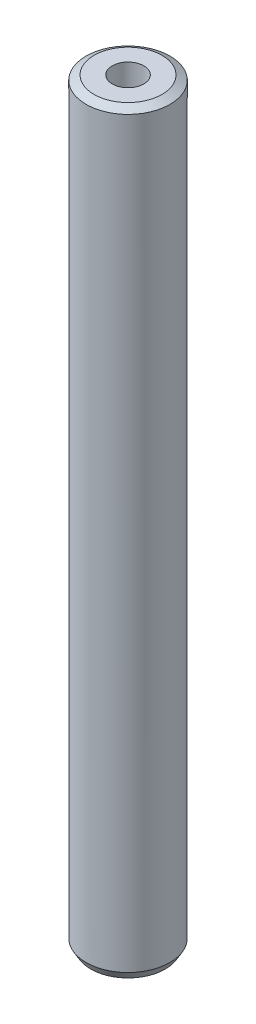
from build123d import *
from OCP.BRepFilletAPI import BRepFilletAPI_MakeChamfer

# Parameters (mm, degrees)
SKETCH1_R           = 10
BOSS_EXTRUDE1_DEPTH = 180.282610111
SKETCH2_R           = 3.759680006
CUT_EXTRUDE1_DEPTH  = 181.836444083
CHAMFER1_SIZE       = 1.09902275
CHAMFER1_SIZE2      = 1.903563242


with BuildPart() as part:
    # Sketch1 → Boss-Extrude1 (new body)
    with BuildSketch(Plane(origin=(0, 0, 0), x_dir=(1, 0, 0), z_dir=(0, 1, 0))):
        Circle(SKETCH1_R)
    extrude(amount=BOSS_EXTRUDE1_DEPTH)

    # Sketch2 → Cut-Extrude1 (cut, through all)
    with BuildSketch(Plane(origin=(0, 0, 0), x_dir=(1, 0, 0), z_dir=(0, 1, 0))):
        Circle(SKETCH2_R)
    extrude(amount=CUT_EXTRUDE1_DEPTH, mode=Mode.SUBTRACT)

    # Chamfer1: one chamfer whose edges measure the first distance from different faces: ONE call of the kernel's chamfer builder (chamfer() names one face for all edges)
    chamfer1_edges_1 = [part.edges().sort_by_distance(p)[0] for p in [
        (-10, 180.282610111, 0),
    ]]
    chamfer1_side_1 = [part.faces().sort_by_distance(p)[0] for p in [
        (-10, 90.141305055, 0),
    ]]
    chamfer1_edges_2 = [part.edges().sort_by_distance(p)[0] for p in [
        (-10, 0, 0),
    ]]
    chamfer1_side_2 = [part.faces().sort_by_distance(p)[0] for p in [
        (-9.717157288, 0, 0),
    ]]
    chamfer1 = BRepFilletAPI_MakeChamfer(part.part.solid().wrapped)
    for e in chamfer1_edges_1:
        chamfer1.Add(CHAMFER1_SIZE, CHAMFER1_SIZE2, e.wrapped, chamfer1_side_1[0].wrapped)  # the first distance lies on this face
    for e in chamfer1_edges_2:
        chamfer1.Add(CHAMFER1_SIZE, CHAMFER1_SIZE2, e.wrapped, chamfer1_side_2[0].wrapped)  # the first distance lies on this face
    add(Compound.cast(chamfer1.Shape()), mode=Mode.REPLACE)


solid = part.part
